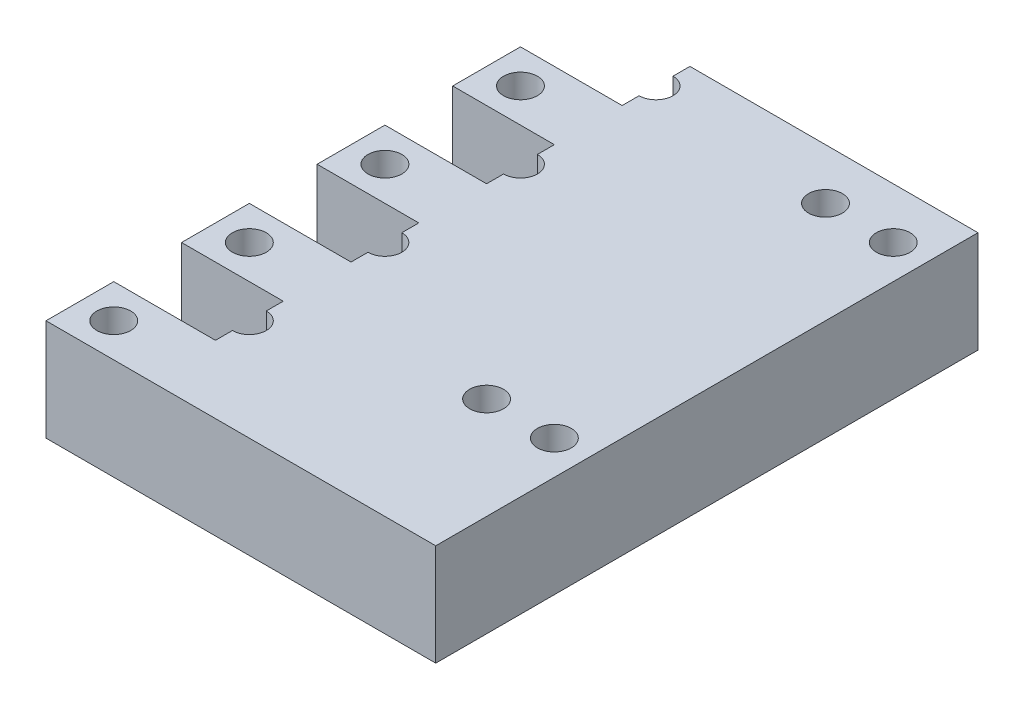
from build123d import *

# Parameters (mm, degrees)
BOSS_EXTRUDE1_DEPTH = 6
SKETCH2_R           = 1
CUT_EXTRUDE1_DEPTH  = 40.862262856


with BuildPart() as part:
    # Sketch1 → Boss-Extrude1 (new body)
    with BuildSketch(Plane(origin=(0, 0, 0), x_dir=(1, 0, 0), z_dir=(0, 1, 0))):
        Polygon((0, 0), (0, 4), (6, 4), (6, 8), (0, 8), (0, 12), (6, 12), (6, 16), (0, 16), (0, 20), (6, 20), (6, 24), (0, 24), (0, 28), (6, 28), (6, 32), (23, 32), (23, 0), align=None)
    extrude(amount=BOSS_EXTRUDE1_DEPTH)

    # Sketch2 → Cut-Extrude1 (cut, through all)
    with BuildSketch(Plane(origin=(0, 6, 0), x_dir=(1, 0, 0), z_dir=(0, 1, 0))):
        with Locations((2, 26)):
            Circle(SKETCH2_R)
        with Locations((2, 18)):
            Circle(SKETCH2_R)
        with Locations((2, 10)):
            Circle(SKETCH2_R)
        with Locations((2, 2)):
            Circle(SKETCH2_R)
        with Locations((6, 22)):
            Circle(SKETCH2_R)
        with Locations((6, 30)):
            Circle(SKETCH2_R)
        with Locations((6, 14)):
            Circle(SKETCH2_R)
        with Locations((6, 6)):
            Circle(SKETCH2_R)
        with Locations((21, 29)):
            Circle(SKETCH2_R)
        with Locations((21, 9)):
            Circle(SKETCH2_R)
        with Locations((17, 29)):
            Circle(SKETCH2_R)
        with Locations((17, 9)):
            Circle(SKETCH2_R)
    extrude(amount=-CUT_EXTRUDE1_DEPTH, mode=Mode.SUBTRACT)


solid = part.part
